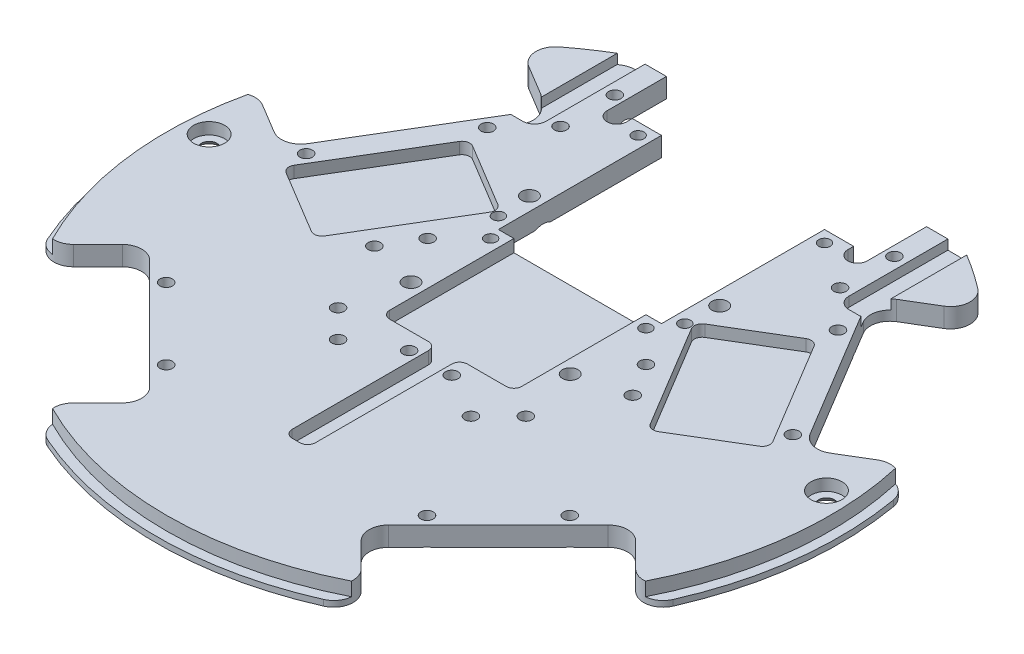
from build123d import *

# Parameters (mm, degrees)
EXTRUDE1_DEPTH     = 5
SKETCH3_W          = 42
SKETCH3_H          = 55.778903352
EXTRUDE2_DEPTH     = 5
EXTRUDE3_DEPTH     = 3.2
EXTRUDE4_DEPTH     = 3
SKETCH6_R          = 1.6
EXTRUDE5_DEPTH     = 5
SKETCH7_R          = 1.5
EXTRUDE6_DEPTH     = 5
EXTRUDE7_DEPTH     = 5
SKETCH9_R          = 1.6
EXTRUDE8_DEPTH     = 5
FILLET2_R          = 2
FILLET3_R          = 5
FILLET4_R          = 5
SKETCH11_R         = 2
EXTRUDE10_DEPTH    = 5
SKETCH20_R         = 2
EXTRUDE19_DEPTH    = 5
SKETCH27_R         = 1.5
EXTRUDE26_DEPTH    = 5
SKETCH29_R         = 4
EXTRUDE28_DEPTH    = 3
SKETCH30_R         = 2
EXTRUDE29_DEPTH    = 2
SKETCH14_R         = 1.6
EXTRUDE30_DEPTH    = 5
CUT_EXTRUDE1_DEPTH = 3.5
SKETCH33_W         = 6
SKETCH33_H         = 28.5
CUT_EXTRUDE3_DEPTH = 2.5
FILLET5_R          = 3
SKETCH34_W         = 5
SKETCH34_H         = 4
CUT_EXTRUDE4_DEPTH = 10
FILLET6_R          = 2.5
SKETCH37_R         = 1.6
CUT_EXTRUDE7_DEPTH = 10
CHAMFER1_SIZE      = 1.5
CHAMFER2_SIZE      = 2
SKETCH38_R         = 1.075
CUT_EXTRUDE8_DEPTH = 10


# Some blends are built 0.0001 mm under size
with BuildPart() as part:
    # Sketch2 → Extrude1 (new body)
    with BuildSketch(Plane(origin=(0, 0, 0), x_dir=(1, 0, 0), z_dir=(0, 1, 0))):
        with BuildLine():
            Line((85.19872856, 22.026725852), (67.306075467, 11.275735239))
            Line((67.306075467, 11.275735239), (41.554171722, 54.134100274))
            Line((41.554171722, 54.134100274), (59.446824814, 64.885090888))
            ThreePointArc((59.446824814, 64.885090888), (51.56746719, 71.307757836), (43, 76.778903352))
            Line((43, 76.778903352), (-43, 76.778903352))
            ThreePointArc((-43, 76.778903352), (-51.56746719, 71.307757836), (-59.446824814, 64.885090888))
            Line((-59.446824814, 64.885090888), (-41.554171722, 54.134100274))
            Line((-41.554171722, 54.134100274), (-67.306075467, 11.275735239))
            Line((-67.306075467, 11.275735239), (-85.19872856, 22.026725852))
            ThreePointArc((-85.19872856, 22.026725852), (-87.344061344, -10.72450222), (-77.339214934, -41.983875874))
            Line((-77.339214934, -41.983875874), (-62.578950135, -27.223611076))
            Line((-62.578950135, -27.223611076), (-27.223611076, -62.578950135))
            Line((-27.223611076, -62.578950135), (-41.983875874, -77.339214934))
            ThreePointArc((-41.983875874, -77.339214934), (0, -88), (41.983875874, -77.339214934))
            Line((41.983875874, -77.339214934), (27.223611076, -62.578950135))
            Line((27.223611076, -62.578950135), (62.578950135, -27.223611076))
            Line((62.578950135, -27.223611076), (77.339214934, -41.983875874))
            ThreePointArc((77.339214934, -41.983875874), (87.344061344, -10.72450222), (85.19872856, 22.026725852))
        make_face()
    extrude(amount=-EXTRUDE1_DEPTH)

    # Sketch3 → Extrude2 (cut)
    with BuildSketch(Plane(origin=(0, 0, 0), x_dir=(1, 0, 0), z_dir=(0, 1, 0))):
        with Locations((0, 48.889451676)):
            Rectangle(SKETCH3_W, SKETCH3_H)
    extrude(amount=-EXTRUDE2_DEPTH, mode=Mode.SUBTRACT)

    # Sketch4 → Extrude3 (cut)
    with BuildSketch(Plane(origin=(0, 0, 0), x_dir=(-1, 0, 0), z_dir=(0, 1, 0))):
        Polygon((17, 13), (17, -27), (-17, -27), (-17, 13), (-3, 13), (-3, 52.119044648), (3, 52.119044648), (3, 13), align=None)
    extrude(amount=-EXTRUDE3_DEPTH, mode=Mode.SUBTRACT)

    # Sketch5 → Extrude4 (cut)
    with BuildSketch(Plane(origin=(0, 0, 0), x_dir=(1, 0, 0), z_dir=(0, 1, 0))):
        Polygon((42.963261822, -4.517536234), (62.678109738, 7.328339489), (44.651777116, 37.329195014), (24.9369292, 25.483319291), align=None)
    extrude4 = extrude(amount=-EXTRUDE4_DEPTH, mode=Mode.SUBTRACT)

    # Mirror1: Extrude4 across plane
    add(extrude4.mirror(Plane(origin=(0, 0, 0), x_dir=(0, 0, 1), z_dir=(1, 0, 0))), mode=Mode.SUBTRACT)

    # Sketch6 → Extrude5 (cut)
    with BuildSketch(Plane(origin=(0, 0, 0), x_dir=(1, 0, 0), z_dir=(0, 1, 0))):
        with Locations(Location((45.163126719, 42.302978441, 0), (0, 0, 270))):
            Circle(SKETCH6_R)
        with Locations(Location((62.674421266, 13.159290217, 0), (0, 0, 270))):
            Circle(SKETCH6_R)
        with Locations(Location((51.972348417, -33.587572106, 0), (0, 0, 270))):
            Circle(SKETCH6_R)
        with Locations(Location((33.587572106, -51.972348417, 0), (0, 0, 270))):
            Circle(SKETCH6_R)
    extrude5 = extrude(amount=-EXTRUDE5_DEPTH, mode=Mode.SUBTRACT)

    # Mirror2: Extrude5 across plane
    add(extrude5.mirror(Plane(origin=(0, 0, 0), x_dir=(0, 0, 1), z_dir=(1, 0, 0))), mode=Mode.SUBTRACT)

    # Sketch7 → Extrude6 (cut)
    with BuildSketch(Plane(origin=(0, 0, 0), x_dir=(-1, 0, 0), z_dir=(0, 1, 0))):
        with Locations(Location((-24, -60, 0), (0, 0, 90))):
            Circle(SKETCH7_R)
        with Locations(Location((-24, -24, 0), (0, 0, 90))):
            Circle(SKETCH7_R)
    extrude6 = extrude(amount=-EXTRUDE6_DEPTH, mode=Mode.SUBTRACT)

    # Mirror3: Extrude6 across plane
    add(extrude6.mirror(Plane(origin=(0, 0, 0), x_dir=(0, 0, 1), z_dir=(1, 0, 0))), mode=Mode.SUBTRACT)

    # Sketch8 → Extrude7 (cut)
    with BuildSketch(Plane(origin=(0, 0, 0), x_dir=(1, 0, 0), z_dir=(0, 1, 0))):
        Polygon((33.5, 68.73438437), (33.5, 63), (21, 63), (21, 76.778903352), (33.5, 76.778903352), align=None)
    extrude7 = extrude(amount=-EXTRUDE7_DEPTH, mode=Mode.SUBTRACT)

    # Mirror4: Extrude7 across plane
    add(extrude7.mirror(Plane(origin=(0, 0, 0), x_dir=(0, 0, 1), z_dir=(1, 0, 0))), mode=Mode.SUBTRACT)

    # Sketch9 → Extrude8 (cut)
    with BuildSketch(Plane(origin=(0, 0, 0), x_dir=(1, 0, 0), z_dir=(0, 1, 0))):
        with Locations(Location((36, 66, 0), (0, 0, 270))):
            Circle(SKETCH9_R)
        with Locations(Location((36, 52, 0), (0, 0, 270))):
            Circle(SKETCH9_R)
    extrude8 = extrude(amount=-EXTRUDE8_DEPTH, mode=Mode.SUBTRACT)

    # Mirror5: Extrude8 across plane
    add(extrude8.mirror(Plane(origin=(0, 0, 0), x_dir=(0, 0, 1), z_dir=(1, 0, 0))), mode=Mode.SUBTRACT)

    # Fillet2
    fillet2_edges = [part.edges().sort_by_distance(p)[0] for p in [
        (42.963261822, -1.5, 4.517536234),
        (24.9369292, -1.5, -25.483319291),
        (44.651777116, -1.5, -37.329195014),
        (62.678109738, -1.5, -7.328339489),
        (-24.9369292, -1.5, -25.483319291),
        (-42.963261822, -1.5, 4.517536234),
        (-62.678109738, -1.5, -7.328339489),
        (-44.651777116, -1.5, -37.329195014),
        (-17, -1.6, 13),
        (17, -1.6, 13),
        (3, -1.6, 13),
        (3, -1.6, 52.119044648),
        (-3, -1.6, 52.119044648),
        (-3, -1.6, 13),
    ]]
    fillet(fillet2_edges, radius=FILLET2_R)

    # Fillet3
    fillet3_edges = [part.edges().sort_by_distance(p)[0] for p in [
        (77.339214934, -2.5, 41.983875874),
        (62.578950135, -2.5, 27.223611076),
        (27.223611076, -2.5, 62.578950135),
        (41.983875874, -2.5, 77.339214934),
        (-41.983875874, -2.5, 77.339214934),
        (-27.223611076, -2.5, 62.578950135),
        (-62.578950135, -2.5, 27.223611076),
        (-77.339214934, -2.5, 41.983875874),
        (-85.19872856, -2.5, -22.026725852),
        (-67.306075467, -2.5, -11.275735239),
        (-41.554171722, -2.5, -54.134100274),
        (-59.446824814, -2.5, -64.885090888),
        (59.446824814, -2.5, -64.885090888),
        (41.554171722, -2.5, -54.134100274),
        (67.306075467, -2.5, -11.275735239),
        (85.19872856, -2.5, -22.026725852),
    ]]
    fillet(fillet3_edges, radius=FILLET3_R)

    # Fillet4
    fillet4_edges = [part.edges().sort_by_distance(p)[0] for p in [
        (-43, -2.5, -76.778903352),
        (43, -2.5, -76.778903352),
    ]]
    fillet(fillet4_edges, radius=FILLET4_R)

    # Sketch11 → Extrude10 (cut)
    with BuildSketch(Plane(origin=(0, 0, 0), x_dir=(1, 0, 0), z_dir=(0, 1, 0))):
        with Locations(Location((24.5, 32.5, 0), (0, 0, 270))):
            Circle(SKETCH11_R)
        with Locations(Location((-24.5, 32.5, 0), (0, 0, 270))):
            Circle(SKETCH11_R)
    extrude(amount=-EXTRUDE10_DEPTH, mode=Mode.SUBTRACT)

    # Sketch20 → Extrude19 (cut)
    with BuildSketch(Plane(origin=(0, 0, 0), x_dir=(1, 0, 0), z_dir=(0, 1, 0))):
        with Locations(Location((20.5, -2, 0), (0, 0, 270))):
            Circle(SKETCH20_R)
        with Locations(Location((-20.5, -2, 0), (0, 0, 270))):
            Circle(SKETCH20_R)
    extrude(amount=-EXTRUDE19_DEPTH, mode=Mode.SUBTRACT)

    # Sketch27 → Extrude26 (cut)
    with BuildSketch(Plane(origin=(0, 0, 0), x_dir=(1, 0, 0), z_dir=(0, 1, 0))):
        with Locations(Location((20, 18, 0), (0, 0, 270))):
            Circle(SKETCH27_R)
        with Locations(Location((-20, 18, 0), (0, 0, 270))):
            Circle(SKETCH27_R)
    extrude(amount=-EXTRUDE26_DEPTH, mode=Mode.SUBTRACT)

    # Sketch29 → Extrude28 (cut)
    with BuildSketch(Plane(origin=(0, 0, 0), x_dir=(1, 0, 0), z_dir=(0, 1, 0))):
        with Locations(Location((-79.5, 5, 0), (0, 0, 270))):
            Circle(SKETCH29_R)
        with Locations(Location((79.5, 5, 0), (0, 0, 270))):
            Circle(SKETCH29_R)
    extrude(amount=-EXTRUDE28_DEPTH, mode=Mode.SUBTRACT)

    # Sketch30 → Extrude29 (cut)
    with BuildSketch(Plane(origin=(0, -3, 0), x_dir=(1, 0, 0), z_dir=(0, 1, 0))):
        with Locations(Location((79.5, 5, 0), (0, 0, 270))):
            Circle(SKETCH30_R)
        with Locations(Location((-79.5, 5, 0), (0, 0, 270))):
            Circle(SKETCH30_R)
    extrude(amount=-EXTRUDE29_DEPTH, mode=Mode.SUBTRACT)

    # Sketch14 → Extrude30 (cut)
    with BuildSketch(Plane(origin=(0, 0, 0), x_dir=(1, 0, 0), z_dir=(0, 1, 0))):
        with Locations(Location((24.183051917, -17.111984105, 0), (0, 0, 270))):
            Circle(SKETCH14_R)
        with Locations(Location((17.111984105, -24.183051917, 0), (0, 0, 270))):
            Circle(SKETCH14_R)
        with Locations(Location((28.11951363, 9.896107983, 0), (0, 0, 270))):
            Circle(SKETCH14_R)
        with Locations(Location((33.269894379, 1.324434976, 0), (0, 0, 270))):
            Circle(SKETCH14_R)
    extrude30 = extrude(amount=-EXTRUDE30_DEPTH, mode=Mode.SUBTRACT)

    # Mirror9: Extrude30 across plane
    add(extrude30.mirror(Plane(origin=(0, 0, 0), x_dir=(0, 0, 1), z_dir=(1, 0, 0))), mode=Mode.SUBTRACT)

    # Sketch31 → Cut-Extrude1 (cut)
    with BuildSketch(Plane(origin=(0, 0, 0), x_dir=(1, 0, 0), z_dir=(0, 1, 0))):
        with BuildLine():
            Line((-74.186723745, 42.503882411), (-76.355926194, 43.74668599))
            ThreePointArc((-76.355926194, 43.74668599), (0, -88), (76.355926194, 43.74668599))
            Line((76.355926194, 43.74668599), (74.186723745, 42.503882411))
            ThreePointArc((74.186723745, 42.503882411), (0, -85.5), (-74.186723745, 42.503882411))
        make_face()
    extrude(amount=-CUT_EXTRUDE1_DEPTH, mode=Mode.SUBTRACT)

    # Sketch33 → Cut-Extrude3 (cut)
    with BuildSketch(Plane(origin=(0, 0, 0), x_dir=(1, 0, 0), z_dir=(0, 1, 0))):
        with Locations((-42, 62.528903352)):
            Rectangle(SKETCH33_W, SKETCH33_H)
        with Locations((42, 62.528903352)):
            Rectangle(SKETCH33_W, SKETCH33_H)
    extrude(amount=-CUT_EXTRUDE3_DEPTH, mode=Mode.SUBTRACT)

    # Fillet5
    fillet5_edges = [part.edges().sort_by_distance(p)[0] for p in [
        (-39, -1.25, -48.278903352),
        (39, -1.25, -48.278903352),
    ]]
    fillet(fillet5_edges, radius=FILLET5_R)

    # Sketch34 → Cut-Extrude4 (cut)
    with BuildSketch(Plane(origin=(0, 0, 0), x_dir=(1, 0, 0), z_dir=(0, 1, 0))):
        with Locations((-31, 61)):
            Rectangle(SKETCH34_W, SKETCH34_H)
        with Locations((31, 61)):
            Rectangle(SKETCH34_W, SKETCH34_H)
    extrude(amount=-CUT_EXTRUDE4_DEPTH, mode=Mode.SUBTRACT)

    # Fillet6
    fillet6_edges = [part.edges().sort_by_distance(p)[0] for p in [
        (28.5, -2.5, -59),
        (33.5, -2.5, -59),
        (-28.5, -2.5, -59),
        (-33.5, -2.5, -59),
    ]]
    fillet(fillet6_edges, radius=FILLET6_R - 0.0001)  # a hair under: the kernel refuses the full size

    # Sketch37 → Cut-Extrude7 (cut)
    with BuildSketch(Plane(origin=(0, 0, 0), x_dir=(1, 0, 0), z_dir=(0, 1, 0))):
        with Locations(Location((-5.5, -17.5, 0), (0, 0, 270))):
            Circle(SKETCH37_R)
        with Locations(Location((5.5, -17.5, 0), (0, 0, 270))):
            Circle(SKETCH37_R)
    extrude(amount=-CUT_EXTRUDE7_DEPTH, mode=Mode.SUBTRACT)

    # Chamfer1
    # the kernel refuses this chamfer: 1.5 mm, written as the material it takes off along each edge
    with BuildSketch(Plane(origin=(45.163126719, -5, -42.302978441), x_dir=(0, 0, 1), z_dir=(-1, 0, 0))) as chamfer1_piece_1:
        Polygon((1.6 + CHAMFER1_SIZE, 0), (1.6, CHAMFER1_SIZE), (1.6, 0), align=None)
    revolve(axis=Axis((45.163126719, -5, -42.302978441), (0, 1, 0)), mode=Mode.SUBTRACT)
    with BuildSketch(Plane(origin=(62.674421266, -5, -13.159290217), x_dir=(0, 0, 1), z_dir=(-1, 0, 0))) as chamfer1_piece_2:
        Polygon((1.6 + CHAMFER1_SIZE, 0), (1.6, CHAMFER1_SIZE), (1.6, 0), align=None)
    revolve(axis=Axis((62.674421266, -5, -13.159290217), (0, 1, 0)), mode=Mode.SUBTRACT)
    with BuildSketch(Plane(origin=(51.972348417, -5, 33.587572106), x_dir=(0, 0, 1), z_dir=(-1, 0, 0))) as chamfer1_piece_3:
        Polygon((1.6 + CHAMFER1_SIZE, 0), (1.6, CHAMFER1_SIZE), (1.6, 0), align=None)
    revolve(axis=Axis((51.972348417, -5, 33.587572106), (0, 1, 0)), mode=Mode.SUBTRACT)
    with BuildSketch(Plane(origin=(33.587572106, -5, 51.972348417), x_dir=(0, 0, 1), z_dir=(-1, 0, 0))) as chamfer1_piece_4:
        Polygon((1.6 + CHAMFER1_SIZE, 0), (1.6, CHAMFER1_SIZE), (1.6, 0), align=None)
    revolve(axis=Axis((33.587572106, -5, 51.972348417), (0, 1, 0)), mode=Mode.SUBTRACT)
    with BuildSketch(Plane(origin=(-45.163126719, -5, -42.302978441), x_dir=(0, 0, 1), z_dir=(1, 0, 0))) as chamfer1_piece_5:
        Polygon((1.6 + CHAMFER1_SIZE, 0), (1.6, -CHAMFER1_SIZE), (1.6, 0), align=None)
    revolve(axis=Axis((-45.163126719, -5, -42.302978441), (0, -1, 0)), mode=Mode.SUBTRACT)
    with BuildSketch(Plane(origin=(-62.674421266, -5, -13.159290217), x_dir=(0, 0, 1), z_dir=(1, 0, 0))) as chamfer1_piece_6:
        Polygon((1.6 + CHAMFER1_SIZE, 0), (1.6, -CHAMFER1_SIZE), (1.6, 0), align=None)
    revolve(axis=Axis((-62.674421266, -5, -13.159290217), (0, -1, 0)), mode=Mode.SUBTRACT)
    with BuildSketch(Plane(origin=(-51.972348417, -5, 33.587572106), x_dir=(0, 0, 1), z_dir=(1, 0, 0))) as chamfer1_piece_7:
        Polygon((1.6 + CHAMFER1_SIZE, 0), (1.6, -CHAMFER1_SIZE), (1.6, 0), align=None)
    revolve(axis=Axis((-51.972348417, -5, 33.587572106), (0, -1, 0)), mode=Mode.SUBTRACT)
    with BuildSketch(Plane(origin=(-33.587572106, -5, 51.972348417), x_dir=(0, 0, 1), z_dir=(1, 0, 0))) as chamfer1_piece_8:
        Polygon((1.6 + CHAMFER1_SIZE, 0), (1.6, -CHAMFER1_SIZE), (1.6, 0), align=None)
    revolve(axis=Axis((-33.587572106, -5, 51.972348417), (0, -1, 0)), mode=Mode.SUBTRACT)
    with BuildSketch(Plane(origin=(24, -5, -60), x_dir=(0, 0, 1), z_dir=(-1, 0, 0))) as chamfer1_piece_9:
        Polygon((1.5 + CHAMFER1_SIZE, 0), (1.5, CHAMFER1_SIZE), (1.5, 0), align=None)
    revolve(axis=Axis((24, -5, -60), (0, 1, 0)), mode=Mode.SUBTRACT)
    with BuildSketch(Plane(origin=(24, -5, -24), x_dir=(0, 0, 1), z_dir=(-1, 0, 0))) as chamfer1_piece_10:
        Polygon((1.5 + CHAMFER1_SIZE, 0), (1.5, CHAMFER1_SIZE), (1.5, 0), align=None)
    revolve(axis=Axis((24, -5, -24), (0, 1, 0)), mode=Mode.SUBTRACT)
    with BuildSketch(Plane(origin=(-24, -5, -60), x_dir=(0, 0, 1), z_dir=(1, 0, 0))) as chamfer1_piece_11:
        Polygon((1.5 + CHAMFER1_SIZE, 0), (1.5, -CHAMFER1_SIZE), (1.5, 0), align=None)
    revolve(axis=Axis((-24, -5, -60), (0, -1, 0)), mode=Mode.SUBTRACT)
    with BuildSketch(Plane(origin=(-24, -5, -24), x_dir=(0, 0, 1), z_dir=(1, 0, 0))) as chamfer1_piece_12:
        Polygon((1.5 + CHAMFER1_SIZE, 0), (1.5, -CHAMFER1_SIZE), (1.5, 0), align=None)
    revolve(axis=Axis((-24, -5, -24), (0, -1, 0)), mode=Mode.SUBTRACT)
    with BuildSketch(Plane(origin=(36, -5, -66), x_dir=(0, 0, 1), z_dir=(-1, 0, 0))) as chamfer1_piece_13:
        Polygon((1.6 + CHAMFER1_SIZE, 0), (1.6, CHAMFER1_SIZE), (1.6, 0), align=None)
    revolve(axis=Axis((36, -5, -66), (0, 1, 0)), mode=Mode.SUBTRACT)
    with BuildSketch(Plane(origin=(36, -5, -52), x_dir=(0, 0, 1), z_dir=(-1, 0, 0))) as chamfer1_piece_14:
        Polygon((1.6 + CHAMFER1_SIZE, 0), (1.6, CHAMFER1_SIZE), (1.6, 0), align=None)
    revolve(axis=Axis((36, -5, -52), (0, 1, 0)), mode=Mode.SUBTRACT)
    with BuildSketch(Plane(origin=(-36, -5, -66), x_dir=(0, 0, 1), z_dir=(1, 0, 0))) as chamfer1_piece_15:
        Polygon((1.6 + CHAMFER1_SIZE, 0), (1.6, -CHAMFER1_SIZE), (1.6, 0), align=None)
    revolve(axis=Axis((-36, -5, -66), (0, -1, 0)), mode=Mode.SUBTRACT)
    with BuildSketch(Plane(origin=(-36, -5, -52), x_dir=(0, 0, 1), z_dir=(1, 0, 0))) as chamfer1_piece_16:
        Polygon((1.6 + CHAMFER1_SIZE, 0), (1.6, -CHAMFER1_SIZE), (1.6, 0), align=None)
    revolve(axis=Axis((-36, -5, -52), (0, -1, 0)), mode=Mode.SUBTRACT)
    with BuildSketch(Plane(origin=(20, -5, -18), x_dir=(0, 0, 1), z_dir=(-1, 0, 0))) as chamfer1_piece_17:
        Polygon((1.5 + CHAMFER1_SIZE, 0), (1.5, CHAMFER1_SIZE), (1.5, 0), align=None)
    revolve(axis=Axis((20, -5, -18), (0, 1, 0)), mode=Mode.SUBTRACT)
    with BuildSketch(Plane(origin=(-20, -5, -18), x_dir=(0, 0, 1), z_dir=(-1, 0, 0))) as chamfer1_piece_18:
        Polygon((1.5 + CHAMFER1_SIZE, 0), (1.5, CHAMFER1_SIZE), (1.5, 0), align=None)
    revolve(axis=Axis((-20, -5, -18), (0, 1, 0)), mode=Mode.SUBTRACT)
    with BuildSketch(Plane(origin=(24.183051917, -5, 17.111984105), x_dir=(0, 0, 1), z_dir=(-1, 0, 0))) as chamfer1_piece_19:
        Polygon((1.6 + CHAMFER1_SIZE, 0), (1.6, CHAMFER1_SIZE), (1.6, 0), align=None)
    revolve(axis=Axis((24.183051917, -5, 17.111984105), (0, 1, 0)), mode=Mode.SUBTRACT)
    with BuildSketch(Plane(origin=(17.111984105, -5, 24.183051917), x_dir=(0, 0, 1), z_dir=(-1, 0, 0))) as chamfer1_piece_20:
        Polygon((1.6 + CHAMFER1_SIZE, 0), (1.6, CHAMFER1_SIZE), (1.6, 0), align=None)
    revolve(axis=Axis((17.111984105, -5, 24.183051917), (0, 1, 0)), mode=Mode.SUBTRACT)
    with BuildSketch(Plane(origin=(28.11951363, -5, -9.896107983), x_dir=(0, 0, 1), z_dir=(-1, 0, 0))) as chamfer1_piece_21:
        Polygon((1.6 + CHAMFER1_SIZE, 0), (1.6, CHAMFER1_SIZE), (1.6, 0), align=None)
    revolve(axis=Axis((28.11951363, -5, -9.896107983), (0, 1, 0)), mode=Mode.SUBTRACT)
    with BuildSketch(Plane(origin=(33.269894379, -5, -1.324434976), x_dir=(0, 0, 1), z_dir=(-1, 0, 0))) as chamfer1_piece_22:
        Polygon((1.6 + CHAMFER1_SIZE, 0), (1.6, CHAMFER1_SIZE), (1.6, 0), align=None)
    revolve(axis=Axis((33.269894379, -5, -1.324434976), (0, 1, 0)), mode=Mode.SUBTRACT)
    with BuildSketch(Plane(origin=(-24.183051917, -5, 17.111984105), x_dir=(0, 0, 1), z_dir=(1, 0, 0))) as chamfer1_piece_23:
        Polygon((1.6 + CHAMFER1_SIZE, 0), (1.6, -CHAMFER1_SIZE), (1.6, 0), align=None)
    revolve(axis=Axis((-24.183051917, -5, 17.111984105), (0, -1, 0)), mode=Mode.SUBTRACT)
    with BuildSketch(Plane(origin=(-17.111984105, -5, 24.183051917), x_dir=(0, 0, 1), z_dir=(1, 0, 0))) as chamfer1_piece_24:
        Polygon((1.6 + CHAMFER1_SIZE, 0), (1.6, -CHAMFER1_SIZE), (1.6, 0), align=None)
    revolve(axis=Axis((-17.111984105, -5, 24.183051917), (0, -1, 0)), mode=Mode.SUBTRACT)
    with BuildSketch(Plane(origin=(-28.11951363, -5, -9.896107983), x_dir=(0, 0, 1), z_dir=(1, 0, 0))) as chamfer1_piece_25:
        Polygon((1.6 + CHAMFER1_SIZE, 0), (1.6, -CHAMFER1_SIZE), (1.6, 0), align=None)
    revolve(axis=Axis((-28.11951363, -5, -9.896107983), (0, -1, 0)), mode=Mode.SUBTRACT)
    with BuildSketch(Plane(origin=(-33.269894379, -5, -1.324434976), x_dir=(0, 0, 1), z_dir=(1, 0, 0))) as chamfer1_piece_26:
        Polygon((1.6 + CHAMFER1_SIZE, 0), (1.6, -CHAMFER1_SIZE), (1.6, 0), align=None)
    revolve(axis=Axis((-33.269894379, -5, -1.324434976), (0, -1, 0)), mode=Mode.SUBTRACT)
    with BuildSketch(Plane(origin=(-5.5, -5, 17.5), x_dir=(0, 0, 1), z_dir=(-1, 0, 0))) as chamfer1_piece_27:
        Polygon((1.6 + CHAMFER1_SIZE, 0), (1.6, CHAMFER1_SIZE), (1.6, 0), align=None)
    revolve(axis=Axis((-5.5, -5, 17.5), (0, 1, 0)), mode=Mode.SUBTRACT)
    with BuildSketch(Plane(origin=(5.5, -5, 17.5), x_dir=(0, 0, 1), z_dir=(-1, 0, 0))) as chamfer1_piece_28:
        Polygon((1.6 + CHAMFER1_SIZE, 0), (1.6, CHAMFER1_SIZE), (1.6, 0), align=None)
    revolve(axis=Axis((5.5, -5, 17.5), (0, 1, 0)), mode=Mode.SUBTRACT)

    # Chamfer2
    # the kernel refuses this chamfer: 2 mm, written as the material it takes off along each edge
    with BuildSketch(Plane(origin=(24.5, -5, -32.5), x_dir=(0, 0, 1), z_dir=(-1, 0, 0))) as chamfer2_piece_1:
        Polygon((2 + CHAMFER2_SIZE, 0), (2, CHAMFER2_SIZE), (2, 0), align=None)
    revolve(axis=Axis((24.5, -5, -32.5), (0, 1, 0)), mode=Mode.SUBTRACT)
    with BuildSketch(Plane(origin=(-24.5, -5, -32.5), x_dir=(0, 0, 1), z_dir=(-1, 0, 0))) as chamfer2_piece_2:
        Polygon((2 + CHAMFER2_SIZE, 0), (2, CHAMFER2_SIZE), (2, 0), align=None)
    revolve(axis=Axis((-24.5, -5, -32.5), (0, 1, 0)), mode=Mode.SUBTRACT)
    with BuildSketch(Plane(origin=(20.5, -5, 2), x_dir=(0, 0, 1), z_dir=(-1, 0, 0))) as chamfer2_piece_3:
        Polygon((2 + CHAMFER2_SIZE, 0), (2, CHAMFER2_SIZE), (2, 0), align=None)
    revolve(axis=Axis((20.5, -5, 2), (0, 1, 0)), mode=Mode.SUBTRACT)
    with BuildSketch(Plane(origin=(-20.5, -5, 2), x_dir=(0, 0, 1), z_dir=(-1, 0, 0))) as chamfer2_piece_4:
        Polygon((2 + CHAMFER2_SIZE, 0), (2, CHAMFER2_SIZE), (2, 0), align=None)
    revolve(axis=Axis((-20.5, -5, 2), (0, 1, 0)), mode=Mode.SUBTRACT)
    with BuildSketch(Plane(origin=(79.5, -5, -5), x_dir=(0, 0, 1), z_dir=(-1, 0, 0))) as chamfer2_piece_5:
        Polygon((2 + CHAMFER2_SIZE, 0), (2, CHAMFER2_SIZE), (2, 0), align=None)
    revolve(axis=Axis((79.5, -5, -5), (0, 1, 0)), mode=Mode.SUBTRACT)
    with BuildSketch(Plane(origin=(-79.5, -5, -5), x_dir=(0, 0, 1), z_dir=(-1, 0, 0))) as chamfer2_piece_6:
        Polygon((2 + CHAMFER2_SIZE, 0), (2, CHAMFER2_SIZE), (2, 0), align=None)
    revolve(axis=Axis((-79.5, -5, -5), (0, 1, 0)), mode=Mode.SUBTRACT)

    # Sketch38 → Cut-Extrude8 (cut)
    with BuildSketch(Plane(origin=(0, -3.2, 0), x_dir=(1, 0, 0), z_dir=(0, 1, 0))):
        with Locations(Location((0, -49, 0), (0, 0, 270))):
            Circle(SKETCH38_R)
    extrude(amount=-CUT_EXTRUDE8_DEPTH, mode=Mode.SUBTRACT)


solid = part.part
